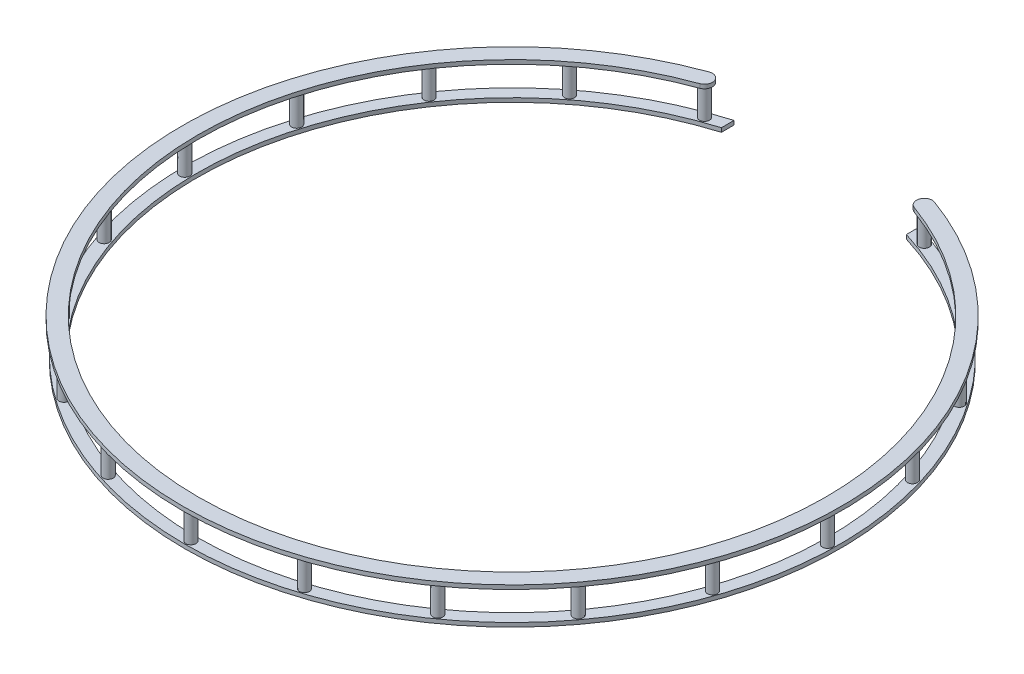
from build123d import *

# Parameters (mm, degrees)
SKETCH1_R                       = 8130.540905
SKETCH1_R_2                     = 7830.540905
BOSS_EXTRUDE1_DEPTH             = 100
CUT_EXTRUDE1_DEPTH              = 100
CUT_EXTRUDE1_DEPTH_BACK         = 100
SKETCH2_W                       = 3700
SKETCH2_H                       = 2006.573318274
SKETCH4_R                       = 125
BOSS_EXTRUDE2_DEPTH             = 750
CIRPATTERN1_COUNT               = 10
CIRPATTERN1_ANGLE               = 160
CIRPATTERN1_THE_OTHER_WAY_COUNT = 10
CIRPATTERN1_THE_OTHER_WAY_ANGLE = 160
BOSS_EXTRUDE3_DEPTH             = 100
CUT_EXTRUDE2_DEPTH              = 2000
CUT_EXTRUDE2_DEPTH_BACK         = 2000
SKETCH6_W                       = 4592.787799638
SKETCH6_H                       = 733.127628032


with BuildPart() as part:
    # Sketch1 → Boss-Extrude1 (new body)
    with BuildSketch(Plane(origin=(0, 0, 0), x_dir=(1, 0, 0), z_dir=(0, 1, 0))):
        Circle(SKETCH1_R)
        Circle(SKETCH1_R_2, mode=Mode.SUBTRACT)
    extrude(amount=BOSS_EXTRUDE1_DEPTH)

    # Sketch2 → Cut-Extrude1 (cut, two sides: drawn at the far end of the back side and taken through both)
    with BuildSketch(Plane(origin=(0, 100, 0), x_dir=(1, 0, 0), z_dir=(0, 1, 0)).offset(-CUT_EXTRUDE1_DEPTH_BACK)):
        with Locations((0, 7830.540905)):
            Rectangle(SKETCH2_W, SKETCH2_H)
    extrude(amount=CUT_EXTRUDE1_DEPTH + CUT_EXTRUDE1_DEPTH_BACK, mode=Mode.SUBTRACT)

    # Sketch4 → Boss-Extrude2 (add)
    with BuildSketch(Plane(origin=(0, 100, 0), x_dir=(1, 0, 0), z_dir=(0, 1, 0))):
        with Locations((0, -7980.540905)):
            Circle(SKETCH4_R)
    boss_extrude2 = extrude(amount=BOSS_EXTRUDE2_DEPTH)

    # CirPattern1: Boss-Extrude2 ×10 about axis
    cirpattern1_axis = Axis((0, 100, 0), (0, 1, 0))
    for i in range(1, CIRPATTERN1_COUNT):
        add(boss_extrude2.rotate(cirpattern1_axis, i * CIRPATTERN1_ANGLE / (CIRPATTERN1_COUNT - 1)))

    # CirPattern1 the other way: Boss-Extrude2 ×10 about axis
    cirpattern1_the_other_way_axis = Axis((0, 100, 0), (0, -1, 0))
    for i in range(1, CIRPATTERN1_THE_OTHER_WAY_COUNT):
        add(boss_extrude2.rotate(cirpattern1_the_other_way_axis, i * CIRPATTERN1_THE_OTHER_WAY_ANGLE / (CIRPATTERN1_THE_OTHER_WAY_COUNT - 1)))

    # Sketch5 → Boss-Extrude3 (add)
    with BuildSketch(Plane(origin=(0, 850, 0), x_dir=(1, 0, 0), z_dir=(0, 1, 0))):
        with BuildLine():
            ThreePointArc((-2796.404660275, 7683.240254702), (0, -8190.682788488), (2796.404660275, 7683.240254702))
            ThreePointArc((2796.404660275, 7683.240254702), (2545.520887751, 7566.15431444), (2662.606828013, 7315.270541915))
            ThreePointArc((2662.606828013, 7315.270541915), (0, -7799.142791237), (-2662.606828013, 7315.270541915))
            ThreePointArc((-2662.606828013, 7315.270541915), (-2545.520887751, 7566.15431444), (-2796.404660275, 7683.240254702))
        make_face()
    extrude(amount=BOSS_EXTRUDE3_DEPTH)

    # Sketch6 → Cut-Extrude2 (cut, two sides: drawn at the far end of the back side and taken through both)
    with BuildSketch(Plane(origin=(0, 100, 0), x_dir=(1, 0, 0), z_dir=(0, 1, 0)).offset(-CUT_EXTRUDE2_DEPTH_BACK)):
        with Locations((0, 7770.8120983)):
            Rectangle(SKETCH6_W, SKETCH6_H)
    extrude(amount=CUT_EXTRUDE2_DEPTH + CUT_EXTRUDE2_DEPTH_BACK, mode=Mode.SUBTRACT)


solid = part.part
